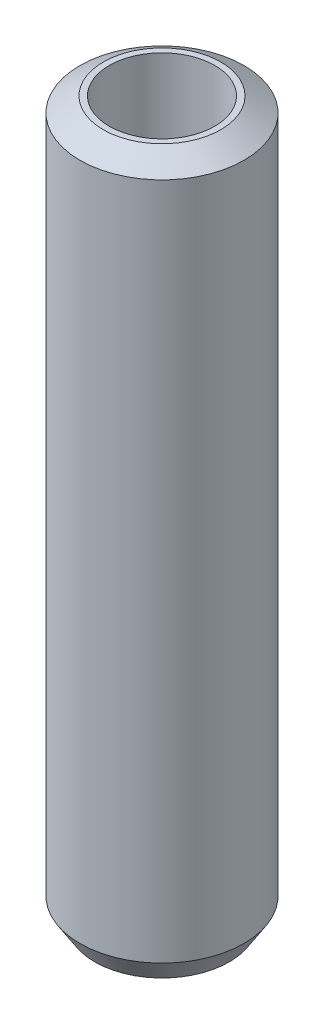
from build123d import *
from OCP.BRepFilletAPI import BRepFilletAPI_MakeChamfer

# Parameters (mm, degrees)
SKETCH1_R           = 30
BOSS_EXTRUDE1_DEPTH = 261.867297198
SKETCH2_R           = 19.273698394
CUT_EXTRUDE1_DEPTH  = 266.281890339
CHAMFER1_SIZE       = 5.396669236
CHAMFER1_SIZE2      = 8.539353478


with BuildPart() as part:
    # Sketch1 → Boss-Extrude1 (new body)
    with BuildSketch(Plane(origin=(0, 0, 0), x_dir=(1, 0, 0), z_dir=(0, 1, 0))):
        Circle(SKETCH1_R)
    extrude(amount=BOSS_EXTRUDE1_DEPTH)

    # Sketch2 → Cut-Extrude1 (cut, through all)
    with BuildSketch(Plane(origin=(0, 0, 0), x_dir=(1, 0, 0), z_dir=(0, 1, 0))):
        Circle(SKETCH2_R)
    extrude(amount=CUT_EXTRUDE1_DEPTH, mode=Mode.SUBTRACT)

    # Chamfer1: one chamfer whose edges measure the first distance from different faces: ONE call of the kernel's chamfer builder (chamfer() names one face for all edges)
    chamfer1_edges_1 = [part.edges().sort_by_distance(p)[0] for p in [
        (-30, 261.867297198, 0),
    ]]
    chamfer1_side_1 = [part.faces().sort_by_distance(p)[0] for p in [
        (-30, 130.933648599, 0),
    ]]
    chamfer1_edges_2 = [part.edges().sort_by_distance(p)[0] for p in [
        (-30, 0, 0),
    ]]
    chamfer1_side_2 = [part.faces().sort_by_distance(p)[0] for p in [
        (-29.151471863, 0, 0),
    ]]
    chamfer1 = BRepFilletAPI_MakeChamfer(part.part.solid().wrapped)
    for e in chamfer1_edges_1:
        chamfer1.Add(CHAMFER1_SIZE, CHAMFER1_SIZE2, e.wrapped, chamfer1_side_1[0].wrapped)  # the first distance lies on this face
    for e in chamfer1_edges_2:
        chamfer1.Add(CHAMFER1_SIZE, CHAMFER1_SIZE2, e.wrapped, chamfer1_side_2[0].wrapped)  # the first distance lies on this face
    add(Compound.cast(chamfer1.Shape()), mode=Mode.REPLACE)


solid = part.part
